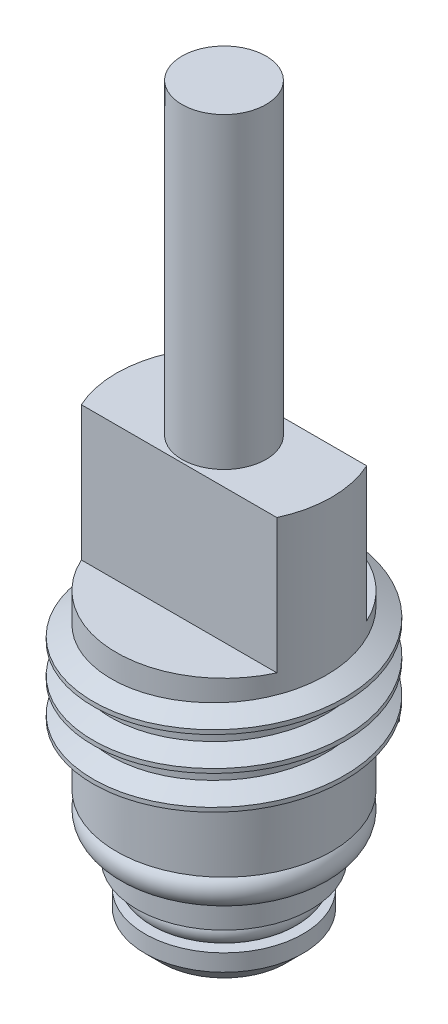
from build123d import *

# Parameters (mm, degrees)
SKETCH1_W          = 1.25
SKETCH1_H          = 9.144
SKETCH1_5_R        = 0.375
SKETCH1_5_R_2      = 0.4875
SKETCH2_W          = 6.4
SKETCH2_H          = 1.865
CUT_EXTRUDE1_DEPTH = 4
THREAD1_PITCH      = 1
CHAMFER1_SIZE      = 0.5


with BuildPart() as part:
    # Sketch1 → Revolve2 (revolve)
    with BuildSketch(Plane.XY):
        with Locations((-0.625, 9.1343)):
            Rectangle(SKETCH1_W, SKETCH1_H)
        Polygon((0, -4.5623), (0, 4.5623), (-1.25, 4.5623), (-3.2, 4.5623), (-3.2, -4.5623), (-2.7125, -4.5623), (-2.225, -4.5623), align=None)
        Polygon((0, -5.5623), (0, -4.5623), (-2.225, -4.5623), (-2.225, -5.0498), (-2.225, -5.5623), align=None)
        Polygon((0, -6.3623), (0, -5.5623), (-2.225, -5.5623), (-2.585, -5.5623), (-2.585, -6.3623), (-1.875, -6.3623), align=None)
        Polygon((0, -8.1123), (0, -7.1123), (-1.875, -7.1123), (-2.35, -7.1123), (-2.35, -8.1123), align=None)
    revolve(axis=Axis((0, 13.7063, 0), (0, -1, 0)))

    # Sketch2 → Cut-Extrude1 (cut)
    with BuildSketch(Plane(origin=(0, 4.5623, 0), x_dir=(1, 0, 0), z_dir=(0, 1, 0))):
        with Locations((0, 2.2675)):
            Rectangle(SKETCH2_W, SKETCH2_H)
        with Locations((0, -2.2675)):
            Rectangle(SKETCH2_W, SKETCH2_H)
    extrude(amount=-CUT_EXTRUDE1_DEPTH, mode=Mode.SUBTRACT)

    # Thread1: the profile of Thread Profile1 profile screwed along a right-hand helix of 3.35 turns, 8 arcs to a turn; built about Z, then put on its axis
    thread1_z = Axis((0, 0, 0), (0, 0, 1))
    thread1_corners = [(3.1997, 0, -0.000173205), (3.741265875, 0, 0.312499999), (3.741265875, 0, 0.437499999), (3.1997, 0, 0.750173202)]
    with BuildLine(mode=Mode.PRIVATE) as thread1_profile:
        Line(thread1_corners[0], thread1_corners[1])
        Line(thread1_corners[1], thread1_corners[2])
        Line(thread1_corners[2], thread1_corners[3])
        Line(thread1_corners[3], thread1_corners[0])
    thread1_cap = Face(thread1_profile.wire())
    thread1_turn_angles = [0, 22.5, 45, 67.5, 90, 112.5, 135, 157.5, 180, 202.5, 225, 247.5, 270, 292.5, 315, 337.5, 360]
    thread1_turn_weights = [1, 0.9238795325112867, 1, 0.9238795325112867, 1, 0.9238795325112867, 1, 0.9238795325112867, 1, 0.9238795325112867, 1, 0.9238795325112867, 1, 0.9238795325112867, 1, 0.9238795325112867, 1]
    thread1_turn_rails = [Edge.make_bspline([Vector(p[0], p[1], 0).rotate(thread1_z, thread1_turn_angles[k]) / thread1_turn_weights[k] + Vector(0, 0, p[2] + THREAD1_PITCH * thread1_turn_angles[k] / 360) for k in range(17)], [0, 0, 0, 1, 1, 2, 2, 3, 3, 4, 4, 5, 5, 6, 6, 7, 7, 8, 8, 8], 2, thread1_turn_weights) for p in thread1_corners]
    thread1_turn_sides = [Face.make_surface_from_curves(thread1_turn_rails[p[0]], thread1_turn_rails[p[1]]) for p in [(0, 1), (1, 2), (2, 3), (3, 0)]]
    thread1_last_angles = [1080, 1102.5, 1125, 1147.5, 1170, 1188, 1206]
    thread1_last_weights = [1, 0.9238795325112867, 1, 0.9238795325112867, 1, 0.9510565162951535, 1]
    thread1_last_rails = [Edge.make_bspline([Vector(p[0], p[1], 0).rotate(thread1_z, thread1_last_angles[k]) / thread1_last_weights[k] + Vector(0, 0, p[2] + THREAD1_PITCH * thread1_last_angles[k] / 360) for k in range(7)], [0, 0, 0, 1, 1, 2, 2, 3, 3, 3], 2, thread1_last_weights) for p in thread1_corners]
    thread1_last_sides = [Face.make_surface_from_curves(thread1_last_rails[p[0]], thread1_last_rails[p[1]]) for p in [(0, 1), (1, 2), (2, 3), (3, 0)]]
    thread1 = Plane(origin=(0, 0.5623, 0), x_dir=(-1, 0, 0), z_dir=(0, -1, 0)) * Solid(Shell([*[p.moved(Location((0, 0, THREAD1_PITCH * i))) for i in range(3) for p in thread1_turn_sides], *thread1_last_sides, thread1_cap, thread1_cap.rotate(thread1_z, 1206).moved(Location((0, 0, THREAD1_PITCH * 1206 / 360)))]))
    add(thread1)

    # Chamfer1
    chamfer1_edges = [part.edges().sort_by_distance(p)[0] for p in [
        (2.35, -8.1123, 0),
    ]]
    chamfer(chamfer1_edges, length=CHAMFER1_SIZE)


with BuildPart() as body_2:
    # Sketch1<5> → Revolve3 (revolve)
    with BuildSketch(Plane.XY):
        with Locations((-1.875, -6.7373)):
            Circle(SKETCH1_5_R)
        with Locations((-2.7125, -5.0498)):
            Circle(SKETCH1_5_R_2)
    revolve(axis=Axis((0, 13.7063, 0), (0, -1, 0)))


solid = Compound([part.part, body_2.part])
